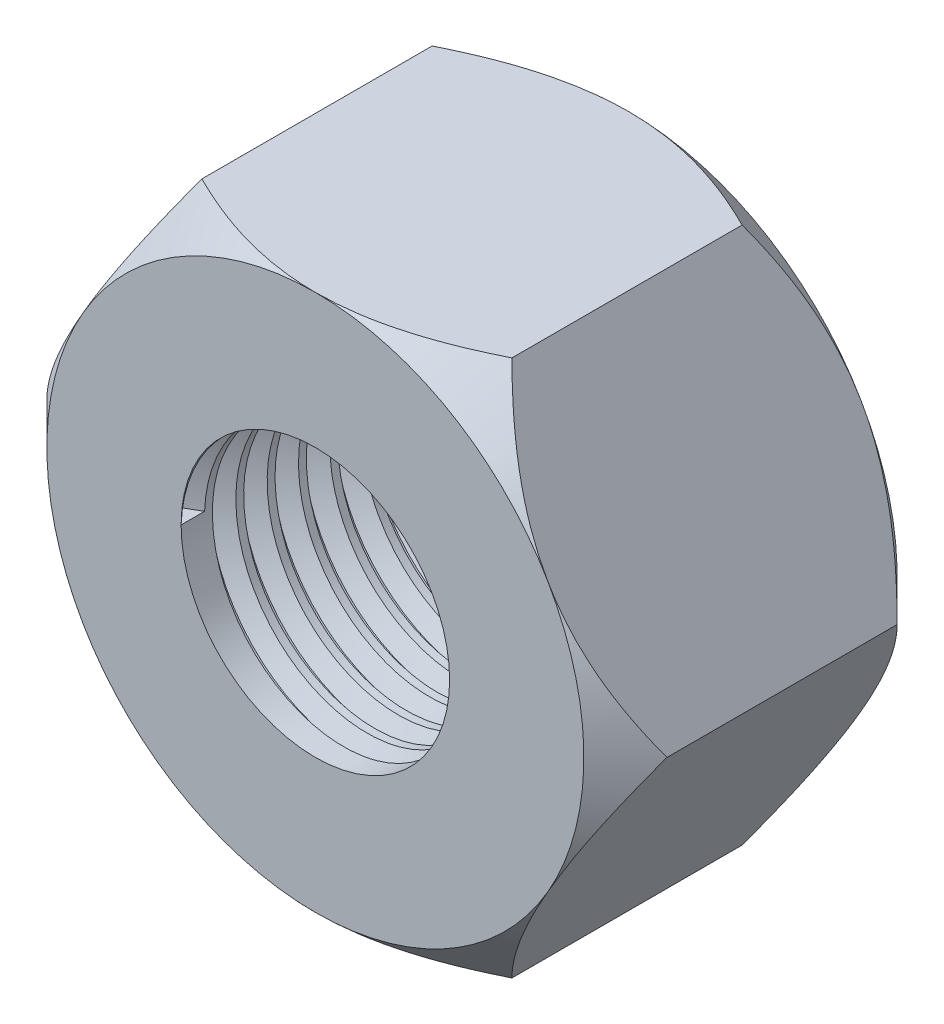
from build123d import *

# Parameters (mm, degrees)
SKETCH1_R               = 15
BOSS_EXTRUDE1_DEPTH     = 17.5
SKETCH2_OUTSIDE_W       = 160.904
SKETCH2_OUTSIDE_H       = 151.622
SKETCH2_OUTSIDE_R       = 30
CUT_EXTRUDE1_DEPTH      = 35
CUT_EXTRUDE1_DRAFT      = -45
MIRROR1_COPY_1_SKETCH_W = 160.904
MIRROR1_COPY_1_SKETCH_H = 151.622
MIRROR1_COPY_1_SKETCH_R = 30
MIRROR1_COPY_1_DEPTH    = 35
MIRROR1_COPY_1_DRAFT    = -45
THREAD1_PITCH           = 3.5


with BuildPart() as part:
    # Sketch1 → Boss-Extrude1 (new, symmetric)
    with BuildSketch(Plane.XY):
        Polygon((34.641016151, 0), (17.320508076, 30), (-17.320508076, 30), (-34.641016151, 0), (-17.320508076, -30), (17.320508076, -30), align=None)
        Circle(SKETCH1_R, mode=Mode.SUBTRACT)
    extrude(amount=BOSS_EXTRUDE1_DEPTH, both=True)


with BuildPart() as cut_extrude1_tool:
    # Sketch2 outside → Cut-Extrude1 (with draft: the straight prism first)
    with BuildSketch(Plane.XY.offset(17.5)):
        Rectangle(SKETCH2_OUTSIDE_W, SKETCH2_OUTSIDE_H)
        Circle(SKETCH2_OUTSIDE_R, mode=Mode.SUBTRACT)
    extrude(amount=-CUT_EXTRUDE1_DEPTH)
    # Cut-Extrude1: the draft: its side faces are tilted about the plane it starts from
    cut_extrude1_sides = [cut_extrude1_tool.faces().sort_by_distance(p)[0] for p in [
        (0, -75.811, 0),
        (80.452, 0, 0),
        (0, 75.811, 0),
        (-80.452, 0, 0),
        (-30, 0, 0),
    ]]
    draft(cut_extrude1_sides, Plane.XY.offset(17.5), CUT_EXTRUDE1_DRAFT)


with BuildPart() as part_1:
    add(part.part)

    # Cut-Extrude1: cut by cut_extrude1_tool
    add(cut_extrude1_tool.part, mode=Mode.SUBTRACT)


with BuildPart() as mirror1_copy_1_tool:
    # Mirror1 copy 1 sketch → Mirror1 copy 1 (with draft: the straight prism first)
    with BuildSketch(Plane(origin=(0, 0, -17.5), x_dir=(1, 0, 0), z_dir=(0, 0, -1))):
        Rectangle(MIRROR1_COPY_1_SKETCH_W, MIRROR1_COPY_1_SKETCH_H)
        Circle(MIRROR1_COPY_1_SKETCH_R, mode=Mode.SUBTRACT)
    extrude(amount=-MIRROR1_COPY_1_DEPTH)
    # Mirror1 copy 1: the draft: its side faces are tilted about the plane it starts from
    mirror1_copy_1_sides = [mirror1_copy_1_tool.faces().sort_by_distance(p)[0] for p in [
        (0, -75.811, 0),
        (80.452, 0, 0),
        (0, 75.811, 0),
        (-80.452, 0, 0),
        (-30, 0, 0),
    ]]
    draft(mirror1_copy_1_sides, Plane(origin=(0, 0, -17.5), x_dir=(1, 0, 0), z_dir=(0, 0, -1)), MIRROR1_COPY_1_DRAFT)


with BuildPart() as part_2:
    add(part_1.part)

    # Mirror1 copy 1: cut by mirror1_copy_1_tool
    add(mirror1_copy_1_tool.part, mode=Mode.SUBTRACT)

    # Thread1: the profile of Thread Profile1 profile screwed along a right-hand helix of 10 turns, 12 arcs to a turn; built about Z, then put on its axis
    thread1_z = Axis((0, 0, 0), (0, 0, 1))
    thread1_corners = [(14.9997, 0, -0.000173205), (16.894430562, 0, 1.093749995), (16.894430562, 0, 1.531249995), (14.9997, 0, 2.625173196)]
    with BuildLine(mode=Mode.PRIVATE) as thread1_profile:
        Line(thread1_corners[0], thread1_corners[1])
        Line(thread1_corners[1], thread1_corners[2])
        Line(thread1_corners[2], thread1_corners[3])
        Line(thread1_corners[3], thread1_corners[0])
    thread1_cap = Face(thread1_profile.wire())
    thread1_turn_angles = [0, 15, 30, 45, 60, 75, 90, 105, 120, 135, 150, 165, 180, 195, 210, 225, 240, 255, 270, 285, 300, 315, 330, 345, 360]
    thread1_turn_weights = [1, 0.9659258262890683, 1, 0.9659258262890683, 1, 0.9659258262890683, 1, 0.9659258262890683, 1, 0.9659258262890683, 1, 0.9659258262890683, 1, 0.9659258262890683, 1, 0.9659258262890683, 1, 0.9659258262890683, 1, 0.9659258262890683, 1, 0.9659258262890683, 1, 0.9659258262890683, 1]
    thread1_turn_rails = [Edge.make_bspline([Vector(p[0], p[1], 0).rotate(thread1_z, thread1_turn_angles[k]) / thread1_turn_weights[k] + Vector(0, 0, p[2] + THREAD1_PITCH * thread1_turn_angles[k] / 360) for k in range(25)], [0, 0, 0, 1, 1, 2, 2, 3, 3, 4, 4, 5, 5, 6, 6, 7, 7, 8, 8, 9, 9, 10, 10, 11, 11, 12, 12, 12], 2, thread1_turn_weights) for p in thread1_corners]
    thread1_turn_sides = [Face.make_surface_from_curves(thread1_turn_rails[p[0]], thread1_turn_rails[p[1]]) for p in [(0, 1), (1, 2), (2, 3), (3, 0)]]
    thread1 = Plane(origin=(0, 0, 17.5), x_dir=(-1, 0, 0), z_dir=(0, 0, -1)) * Solid(Shell([*[p.moved(Location((0, 0, THREAD1_PITCH * i))) for i in range(10) for p in thread1_turn_sides], thread1_cap, thread1_cap.rotate(thread1_z, 3600).moved(Location((0, 0, THREAD1_PITCH * 3600 / 360)))]))
    add(thread1, mode=Mode.SUBTRACT)


solid = part_2.part
